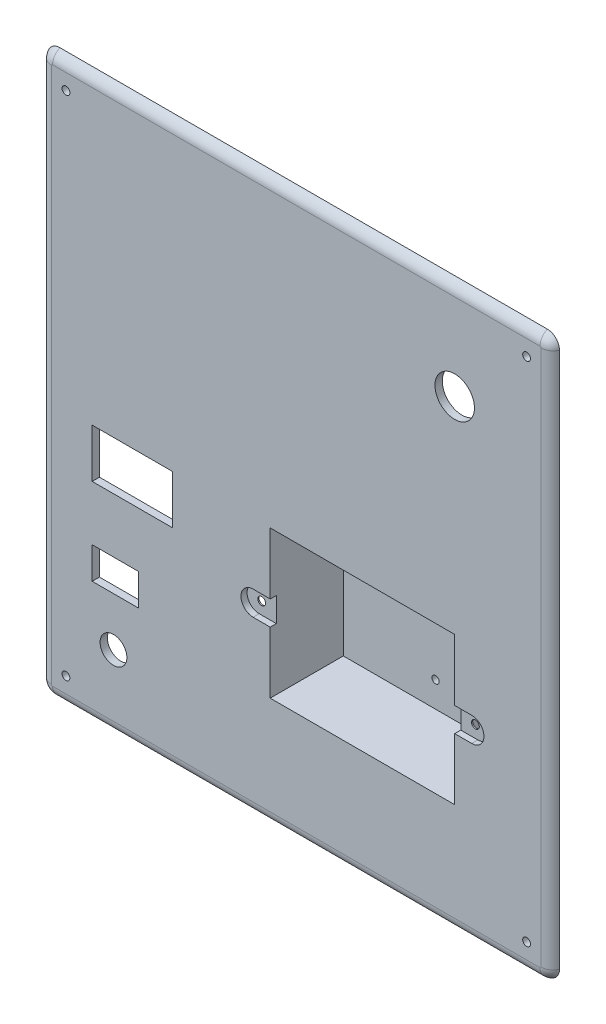
from build123d import *

# Parameters (mm, degrees)
SKETCH1_R           = 1.6
SKETCH1_R_2         = 8.1
SKETCH1_R_3         = 5.5
SKETCH1_W           = 19
SKETCH1_H           = 13
SKETCH1_W_2         = 75.7
SKETCH1_H_2         = 60.5
SKETCH1_W_3         = 33
SKETCH1_H_3         = 20
BOSS_EXTRUDE1_DEPTH = 3
SKETCH2_W           = 81.7
SKETCH2_H           = 66.5
SKETCH2_W_2         = 75.7
SKETCH2_H_2         = 60.5
BOSS_EXTRUDE2_DEPTH = 30
SKETCH3_W           = 75.7
SKETCH3_H           = 60.5
SKETCH3_R           = 1.5
BOSS_EXTRUDE3_DEPTH = 3
SKETCH4_R           = 3
CUT_EXTRUDE1_DEPTH  = 3
FILLET1_R           = 5
CUT_EXTRUDE2_DEPTH  = 2.5
SKETCH6_R           = 1.6
CUT_EXTRUDE3_DEPTH  = 313.938092919


with BuildPart() as part:
    # Sketch1 → Boss-Extrude1 (new body)
    with BuildSketch(Plane.XY):
        with BuildLine():
            Line((5, 0), (205, 0))
            ThreePointArc((205, 0), (208.535533906, 1.464466094), (210, 5))
            Line((210, 5), (210, 225))
            ThreePointArc((210, 225), (208.535533906, 228.535533906), (205, 230))
            Line((205, 230), (5, 230))
            ThreePointArc((5, 230), (1.464466094, 228.535533906), (0, 225))
            Line((0, 225), (0, 5))
            ThreePointArc((0, 5), (1.464466094, 1.464466094), (5, 0))
        make_face()
        with Locations((10.5, 219)):
            Circle(SKETCH1_R, mode=Mode.SUBTRACT)
        with Locations(Location((10.5, 11, 0), (0, 0, 180))):
            Circle(SKETCH1_R, mode=Mode.SUBTRACT)
        with Locations((199.5, 11)):
            Circle(SKETCH1_R, mode=Mode.SUBTRACT)
        with Locations(Location((199.5, 219, 0), (0, 0, 180))):
            Circle(SKETCH1_R, mode=Mode.SUBTRACT)
        with Locations((170, 190)):
            Circle(SKETCH1_R_2, mode=Mode.SUBTRACT)
        with Locations((30, 30)):
            Circle(SKETCH1_R_3, mode=Mode.SUBTRACT)
        with Locations((30.75, 56.5)):
            Rectangle(SKETCH1_W, SKETCH1_H, mode=Mode.SUBTRACT)
        with Locations((132.15, 75.25)):
            Rectangle(SKETCH1_W_2, SKETCH1_H_2, mode=Mode.SUBTRACT)
        with Locations((37.75, 95.5)):
            Rectangle(SKETCH1_W_3, SKETCH1_H_3, mode=Mode.SUBTRACT)
    extrude(amount=BOSS_EXTRUDE1_DEPTH)

    # Sketch2 → Boss-Extrude2 (add)
    with BuildSketch(Plane(origin=(0, 0, 0), x_dir=(-1, 0, 0), z_dir=(0, 0, -1))):
        with Locations((-132.15, 75.25)):
            Rectangle(SKETCH2_W, SKETCH2_H)
        with Locations((-132.15, 75.25)):
            Rectangle(SKETCH2_W_2, SKETCH2_H_2, mode=Mode.SUBTRACT)
    extrude(amount=BOSS_EXTRUDE2_DEPTH)

    # Sketch4 → Cut-Extrude1 (cut)
    with BuildSketch(Plane(origin=(94.3, 0, 0), x_dir=(0, 0, -1), z_dir=(1, 0, 0))):
        with Locations(Location((23, 85.5, 0), (0, 0, 90))):
            Circle(SKETCH4_R)
    extrude(amount=-CUT_EXTRUDE1_DEPTH, mode=Mode.SUBTRACT)

    # Fillet1
    # the kernel refuses this fillet: 5 mm, written as the material it takes off along each edge
    with BuildSketch(Plane(origin=(205, 225, 3), x_dir=(1, 0, 0), z_dir=(0, -1, 0))) as fillet1_piece_1:
        with BuildLine():
            CenterArc((0.417424305, -5), FILLET1_R, 23.578178478, 66.421821522)
            Line((5, -3), (5.091651514, -2.96))
            ThreePointArc((5.091651514, -2.96), (5.1, -1.5), (5.1, 0))
            Line((5.1, 0), (5, 0.1))
            Line((5, 0.1), (0.417424305, 0.1))
            Line((0.417424305, 0.1), (0.417424305, 0))
        make_face()
    revolve(axis=Axis((205, 225, 3), (0, 0, 1)), revolution_arc=90, mode=Mode.SUBTRACT)
    with BuildSketch(Plane(origin=(210, 5, 3), x_dir=(-1, 0, 0), z_dir=(0, 1, 0))) as fillet1_piece_2:
        with BuildLine():
            CenterArc((4.582575695, -5), FILLET1_R, 90, 66.421821522)
            Line((0, -3), (-0.091651514, -2.96))
            ThreePointArc((-0.091651514, -2.96), (-0.1, -1.5), (-0.1, 0))
            Line((-0.1, 0), (0, 0.1))
            Line((0, 0.1), (4.582575695, 0.1))
            Line((4.582575695, 0.1), (4.582575695, 0))
        make_face()
    extrude(amount=220, mode=Mode.SUBTRACT)
    with BuildSketch(Plane(origin=(205, 5, 3), x_dir=(0, -1, 0), z_dir=(-1, 0, 0))) as fillet1_piece_3:
        with BuildLine():
            CenterArc((0.417424305, -5), FILLET1_R, 23.578178478, 66.421821522)
            Line((5, -3), (5.091651514, -2.96))
            ThreePointArc((5.091651514, -2.96), (5.1, -1.5), (5.1, 0))
            Line((5.1, 0), (5, 0.1))
            Line((5, 0.1), (0.417424305, 0.1))
            Line((0.417424305, 0.1), (0.417424305, 0))
        make_face()
    revolve(axis=Axis((205, 5, 3), (0, 0, 1)), revolution_arc=90, mode=Mode.SUBTRACT)
    with BuildSketch(Plane(origin=(5, 0, 3), x_dir=(0, 1, 0), z_dir=(1, 0, 0)), Plane(origin=(205, 230, 3), x_dir=(0, -1, 0), z_dir=(-1, 0, 0))) as fillet1_piece_4:
        with BuildLine():
            CenterArc((4.582575695, -5), FILLET1_R, 90, 66.421821522)
            Line((0, -3), (-0.091651514, -2.96))
            ThreePointArc((-0.091651514, -2.96), (-0.1, -1.5), (-0.1, 0))
            Line((-0.1, 0), (0, 0.1))
            Line((0, 0.1), (4.582575695, 0.1))
            Line((4.582575695, 0.1), (4.582575695, 0))
        make_face()
    extrude(amount=200, mode=Mode.SUBTRACT)
    with BuildSketch(Plane(origin=(5, 5, 3), x_dir=(-1, 0, 0), z_dir=(0, 1, 0))) as fillet1_piece_5:
        with BuildLine():
            CenterArc((0.417424305, -5), FILLET1_R, 23.578178478, 66.421821522)
            Line((0.417424305, 0), (0.417424305, 0.1))
            Line((0.417424305, 0.1), (5, 0.1))
            Line((5, 0.1), (5.1, 0))
            ThreePointArc((5.1, 0), (5.1, -1.5), (5.091651514, -2.96))
            Line((5.091651514, -2.96), (5, -3))
        make_face()
    revolve(axis=Axis((5, 5, 3), (0, 0, 1)), revolution_arc=90, mode=Mode.SUBTRACT)
    with BuildSketch(Plane(origin=(0, 225, 3), x_dir=(0, 0, -1), z_dir=(0, -1, 0))) as fillet1_piece_6:
        with BuildLine():
            CenterArc((5, 4.582575695), FILLET1_R, 180, 66.421821522)
            Line((0, 4.582575695), (-0.1, 4.582575695))
            Line((-0.1, 4.582575695), (-0.1, 0))
            Line((-0.1, 0), (0, -0.1))
            ThreePointArc((0, -0.1), (1.5, -0.1), (2.96, -0.091651514))
            Line((2.96, -0.091651514), (3, 0))
        make_face()
    extrude(amount=220, mode=Mode.SUBTRACT)
    with BuildSketch(Plane(origin=(5, 225, 3), x_dir=(0, 1, 0), z_dir=(1, 0, 0))) as fillet1_piece_7:
        with BuildLine():
            CenterArc((0.417424305, -5), FILLET1_R, 23.578178478, 66.421821522)
            Line((0.417424305, 0), (0.417424305, 0.1))
            Line((0.417424305, 0.1), (5, 0.1))
            Line((5, 0.1), (5.1, 0))
            ThreePointArc((5.1, 0), (5.1, -1.5), (5.091651514, -2.96))
            Line((5.091651514, -2.96), (5, -3))
        make_face()
    revolve(axis=Axis((5, 225, 3), (0, 0, 1)), revolution_arc=90, mode=Mode.SUBTRACT)

    # Sketch5 → Cut-Extrude2 (cut)
    with BuildSketch(Plane.XY.offset(3)):
        with BuildLine():
            Line((94.3, 80.25), (87.3, 80.25))
            ThreePointArc((87.3, 80.25), (82.3, 75.25), (87.3, 70.25))
            Line((87.3, 70.25), (94.3, 70.25))
            Line((94.3, 70.25), (94.3, 80.25))
        make_face()
        with BuildLine():
            Line((170, 80.25), (177, 80.25))
            ThreePointArc((177, 80.25), (182, 75.25), (177, 70.25))
            Line((177, 70.25), (170, 70.25))
            Line((170, 70.25), (170, 80.25))
        make_face()
    extrude(amount=-CUT_EXTRUDE2_DEPTH, mode=Mode.SUBTRACT)

    # Sketch6 → Cut-Extrude3 (cut, through all)
    with BuildSketch(Plane.XY.offset(0.5)):
        with Locations((88.3, 75.25)):
            Circle(SKETCH6_R)
        with Locations((176, 75.25)):
            Circle(SKETCH6_R)
    extrude(amount=-CUT_EXTRUDE3_DEPTH, mode=Mode.SUBTRACT)


with BuildPart() as body_2:
    # Sketch3 → Boss-Extrude3 (new body)
    with BuildSketch(Plane(origin=(0, 0, -30), x_dir=(-1, 0, 0), z_dir=(0, 0, -1))):
        with Locations((-132.15, 75.25)):
            Rectangle(SKETCH3_W, SKETCH3_H)
        with Locations((-132.15, 95)):
            Circle(SKETCH3_R, mode=Mode.SUBTRACT)
        with Locations(Location((-132.15, 55.5, 0), (0, 0, 180))):
            Circle(SKETCH3_R, mode=Mode.SUBTRACT)
    extrude(amount=-BOSS_EXTRUDE3_DEPTH)


solid = Compound([part.part, body_2.part])
